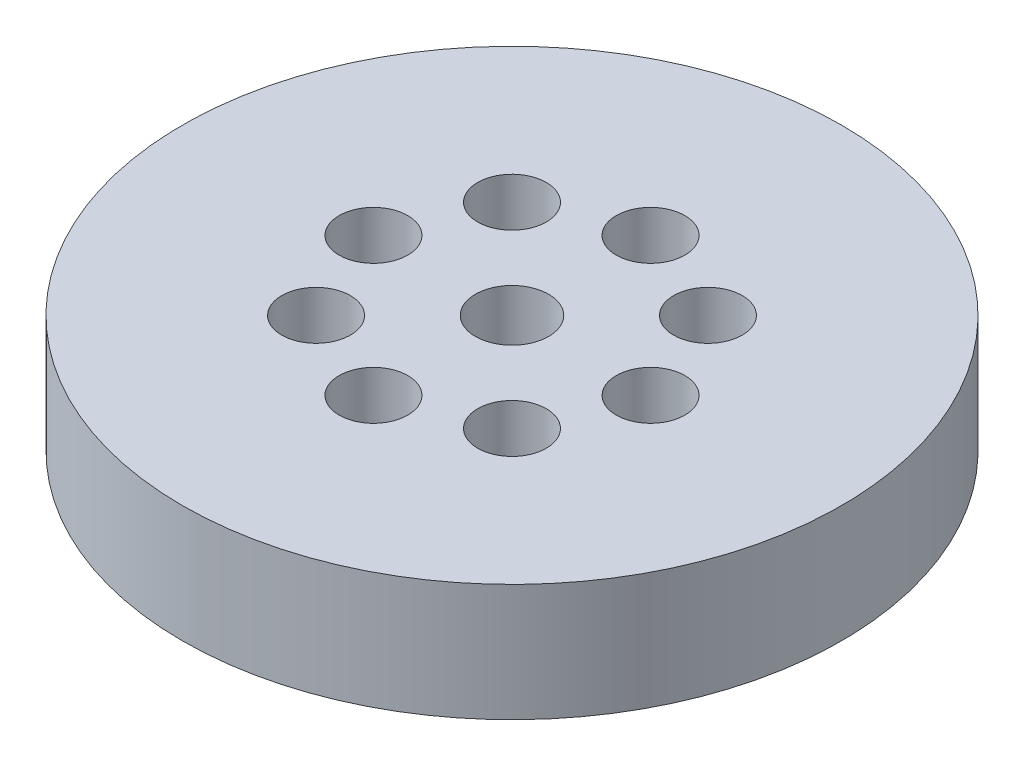
from build123d import *

# Parameters (mm, degrees)
SKETCH1_R           = 45
BOSS_EXTRUDE1_DEPTH = 16
SKETCH2_R           = 5
CUT_EXTRUDE1_DEPTH  = 66.620118866
SKETCH3_R           = 4.684776272
CUT_EXTRUDE2_DEPTH  = 9.619135429
CIRPATTERN1_COUNT   = 8


with BuildPart() as part:
    # Sketch1 → Boss-Extrude1 (new body)
    with BuildSketch(Plane(origin=(0, 0, 0), x_dir=(1, 0, 0), z_dir=(0, 1, 0))):
        Circle(SKETCH1_R)
    extrude(amount=BOSS_EXTRUDE1_DEPTH)

    # Sketch2 → Cut-Extrude1 (cut, through all)
    with BuildSketch(Plane(origin=(0, 0, 0), x_dir=(1, 0, 0), z_dir=(0, 1, 0))):
        Circle(SKETCH2_R)
    extrude(amount=CUT_EXTRUDE1_DEPTH, mode=Mode.SUBTRACT)

    # Sketch3 → Cut-Extrude2 (cut)
    with BuildSketch(Plane(origin=(0, 16, 0), x_dir=(1, 0, 0), z_dir=(0, 1, 0))):
        with Locations((-18.918588921, 0)):
            Circle(SKETCH3_R)
    cut_extrude2 = extrude(amount=-CUT_EXTRUDE2_DEPTH, mode=Mode.SUBTRACT)

    # CirPattern1: Cut-Extrude2 ×8 about axis
    cirpattern1_axis = Axis((0, 0, 0), (0, 1, 0))
    for i in range(1, CIRPATTERN1_COUNT):
        add(cut_extrude2.rotate(cirpattern1_axis, i * 360 / CIRPATTERN1_COUNT), mode=Mode.SUBTRACT)


solid = part.part
